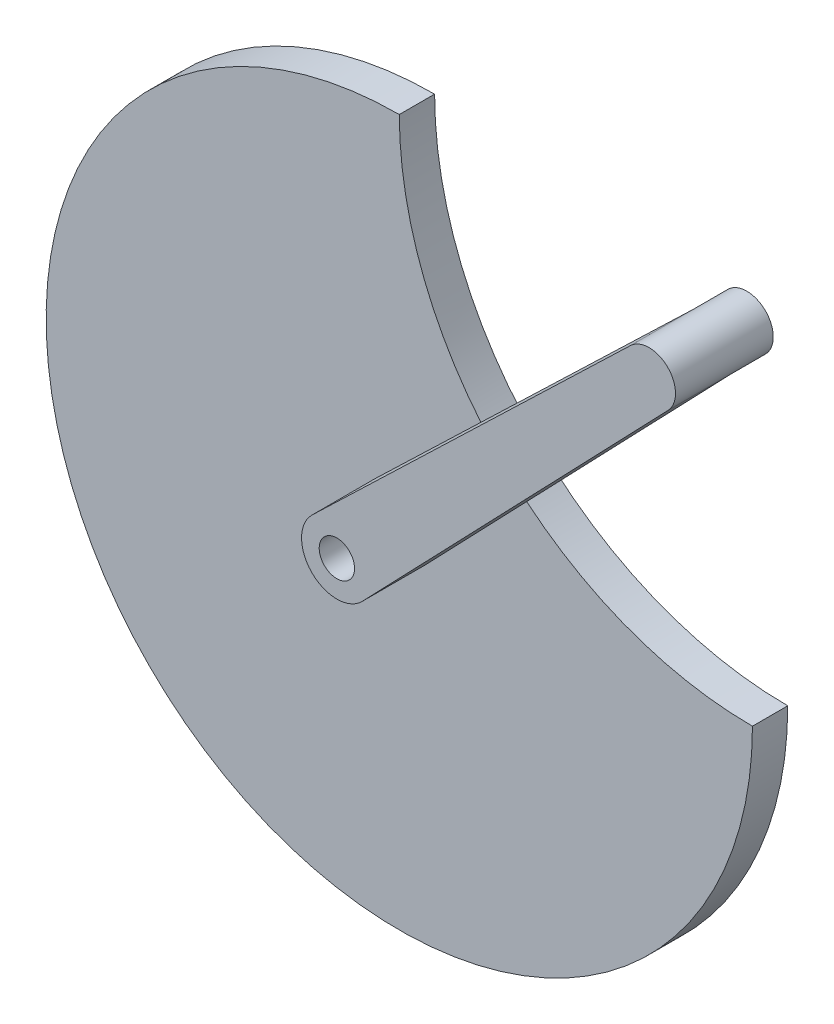
from build123d import *

# Parameters (mm, degrees)
SALIENTE_EXTRUIR2_START       = -1.018233765
SALIENTE_EXTRUIR2_OUTLINE_R   = 0.509116882
SALIENTE_EXTRUIR2_OUTLINE_R_2 = 0.763675324
SALIENTE_EXTRUIR2_DEPTH       = 1.018233765
CROQUIS2_R                    = 0.509116882
SALIENTE_EXTRUIR3_DEPTH       = 1.8


# Read off the part's stored shape, not the designer's step: Saliente-Extruir2
with BuildPart() as part:
    # Saliente-Extruir2 outline → Saliente-Extruir2 (new body)
    # profile 1 of 2: a face of its own
    with BuildSketch(Plane.XY.offset(SALIENTE_EXTRUIR2_START)):
        with BuildLine():
            ThreePointArc((-7.817662351, 0), (-15.017662351, 2.982337649), (-18, 10.182337649))
            ThreePointArc((-18, 10.182337649), (-25.2, -7.2), (-7.817662351, 0))
        make_face()
        with Locations((-18, 0)):
            Circle(SALIENTE_EXTRUIR2_OUTLINE_R, mode=Mode.SUBTRACT)
    # profile 2 of 2: a face of its own
    with BuildSketch(Plane.XY.offset(SALIENTE_EXTRUIR2_START)):
        with Locations((-9, 9)):
            Circle(SALIENTE_EXTRUIR2_OUTLINE_R_2)
        with BuildLine():
            Line((-8.64, 9.36), (-8.632797118, 9.352797118))
            ThreePointArc((-8.632797118, 9.352797118), (-8.64, 8.64), (-9.352727993, 8.632872007))
            Line((-9.352727993, 8.632872007), (-9.36, 8.64))
            ThreePointArc((-9.36, 8.64), (-9.36, 9.36), (-8.64, 9.36))
        make_face(mode=Mode.SUBTRACT)
    extrude(amount=SALIENTE_EXTRUIR2_DEPTH)

    # Croquis2 → Saliente-Extruir3 (add)
    with BuildSketch(Plane.XY):
        with BuildLine():
            Line((-17.265744014, -0.705455986), (-8.449308011, 8.470908011))
            ThreePointArc((-8.449308011, 8.470908011), (-8.46, 9.54), (-9.529091989, 9.550691989))
            Line((-9.529091989, 9.550691989), (-18.705455986, 0.734255986))
            ThreePointArc((-18.705455986, 0.734255986), (-18.72, -0.72), (-17.265744014, -0.705455986))
        make_face()
        with Locations((-18, 0)):
            Circle(CROQUIS2_R, mode=Mode.SUBTRACT)
    extrude(amount=SALIENTE_EXTRUIR3_DEPTH)


solid = part.part
